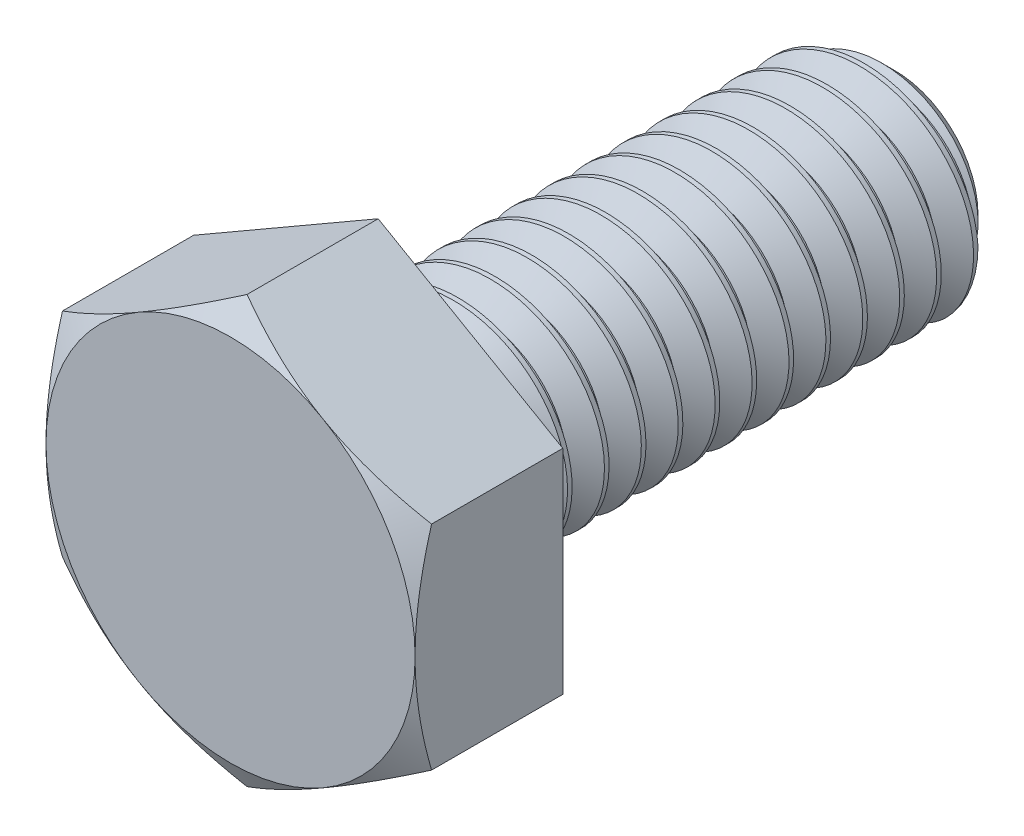
from build123d import *

# Parameters (mm, degrees)
BOSS_EXTRUDE1_DEPTH = 4
SKETCH4_OUTSIDE_W   = 87.92
SKETCH4_OUTSIDE_H   = 89.468
SKETCH4_OUTSIDE_R   = 5
CUT_EXTRUDE1_DEPTH  = 20.553345835
CUT_EXTRUDE1_DRAFT  = -60
CUT_SWEEP1_PITCH    = 1
CUT_SWEEP1_TO       = 14


with BuildPart() as part:
    # Sketch2 → Revolve1 (revolve)
    with BuildSketch(Plane(origin=(0, 0, 0), x_dir=(0, 0, -1), z_dir=(1, 0, 0)), mode=Mode.PRIVATE) as revolve1_sk:
        Polygon((-9, 5), (-9, 0), (9, 0), (9, 2.25), (8.25, 3), (-5, 3), (-5, 5), align=None)
    revolve(revolve1_sk.sketch.rotate(Axis((0, 0, 9), (0, 0, -1)), 90), axis=Axis((0, 0, 9), (0, 0, -1)))

    # Sketch3 → Boss-Extrude1 (add)
    with BuildSketch(Plane.XY.offset(9)):
        Polygon((0, 5.773502692), (-5, 2.886751346), (-5, -2.886751346), (0, -5.773502692), (5, -2.886751346), (5, 2.886751346), align=None)
    extrude(amount=-BOSS_EXTRUDE1_DEPTH)


with BuildPart() as cut_extrude1_tool:
    # Sketch4 outside → Cut-Extrude1 (with draft: the straight prism first)
    with BuildSketch(Plane.XY.offset(9)):
        Rectangle(SKETCH4_OUTSIDE_W, SKETCH4_OUTSIDE_H)
        Circle(SKETCH4_OUTSIDE_R, mode=Mode.SUBTRACT)
    extrude(amount=-CUT_EXTRUDE1_DEPTH)
    # Cut-Extrude1: the draft: its side faces are tilted about the plane it starts from
    cut_extrude1_sides = [cut_extrude1_tool.faces().sort_by_distance(p)[0] for p in [
        (0, -44.734, -1.276672917),
        (43.96, 0, -1.276672917),
        (0, 44.734, -1.276672917),
        (-43.96, 0, -1.276672917),
        (-5, 0, -1.276672917),
    ]]
    draft(cut_extrude1_sides, Plane.XY.offset(9), CUT_EXTRUDE1_DRAFT)


with BuildPart() as part_1:
    add(part.part)

    # Cut-Extrude1: cut by cut_extrude1_tool
    add(cut_extrude1_tool.part, mode=Mode.SUBTRACT)


with BuildPart() as body_2:
    # Split1: read off the stored shape, not the designer's step
    # Split1: the piece on the far side of the plane
    add(part_1.part)
    split(bisect_by=Plane.XY.offset(5), keep=Keep.BOTTOM)

    # Cut-Sweep1: arcs per turn and ends read off the stored shape
    # Cut-Sweep1: the profile of Sketch7 screwed along a right-hand helix through 15 turns, 8 arcs to a turn; built about Z, then put on its axis
    cut_sweep1_z = Axis((0, 0, 0), (0, 0, 1))
    cut_sweep1_corners = [(3.054126588, 0, 0.03125), (2.350480947, 0, -0.375), (2.350480947, 0, -0.5), (3.054126588, 0, -0.90625)]
    with BuildLine(mode=Mode.PRIVATE) as cut_sweep1_profile:
        Line(cut_sweep1_corners[0], cut_sweep1_corners[1])
        Line(cut_sweep1_corners[1], cut_sweep1_corners[2])
        Line(cut_sweep1_corners[2], cut_sweep1_corners[3])
        Line(cut_sweep1_corners[3], cut_sweep1_corners[0])
    cut_sweep1_cap = Face(cut_sweep1_profile.wire())
    cut_sweep1_turn_angles = [0, 22.5, 45, 67.5, 90, 112.5, 135, 157.5, 180, 202.5, 225, 247.5, 270, 292.5, 315, 337.5, 360]
    cut_sweep1_turn_weights = [1, 0.9238795325112867, 1, 0.9238795325112867, 1, 0.9238795325112867, 1, 0.9238795325112867, 1, 0.9238795325112867, 1, 0.9238795325112867, 1, 0.9238795325112867, 1, 0.9238795325112867, 1]
    cut_sweep1_turn_rails = [Edge.make_bspline([Vector(p[0], p[1], 0).rotate(cut_sweep1_z, cut_sweep1_turn_angles[k]) / cut_sweep1_turn_weights[k] + Vector(0, 0, p[2] + CUT_SWEEP1_PITCH * cut_sweep1_turn_angles[k] / 360) for k in range(17)], [0, 0, 0, 1, 1, 2, 2, 3, 3, 4, 4, 5, 5, 6, 6, 7, 7, 8, 8, 8], 2, cut_sweep1_turn_weights) for p in cut_sweep1_corners]
    cut_sweep1_turn_sides = [Face.make_surface_from_curves(cut_sweep1_turn_rails[p[0]], cut_sweep1_turn_rails[p[1]]) for p in [(0, 1), (1, 2), (2, 3), (3, 0)]]
    cut_sweep1 = Plane(origin=(0, 0, -9), x_dir=(0, 1, 0), z_dir=(0, 0, 1)) * split(Solid(Shell([*[p.moved(Location((0, 0, CUT_SWEEP1_PITCH * i))) for i in range(15) for p in cut_sweep1_turn_sides], cut_sweep1_cap, cut_sweep1_cap.rotate(cut_sweep1_z, 5400).moved(Location((0, 0, CUT_SWEEP1_PITCH * 5400 / 360)))])), bisect_by=Plane.XY.offset(CUT_SWEEP1_TO), keep=Keep.BOTTOM, mode=Mode.PRIVATE)
    add(cut_sweep1, mode=Mode.SUBTRACT)


with BuildPart() as part_2:
    add(part_1.part)

    # Split1
    split(bisect_by=Plane.XY.offset(5), keep=Keep.TOP)

    add(body_2.part)  # Boss-Extrude2 merges body 2
    # Boss-Extrude2: read off the stored shape, not the designer's step
    # Boss-Extrude2 outline → Boss-Extrude2 (revolve)
    with BuildSketch(Plane.XZ):
        Polygon((2.350479841, 5), (2.350479841, 3.21545803), (3, 5), align=None)
    revolve(axis=Axis((0, 0, 0), (0, 0, 1)))


solid = part_2.part
